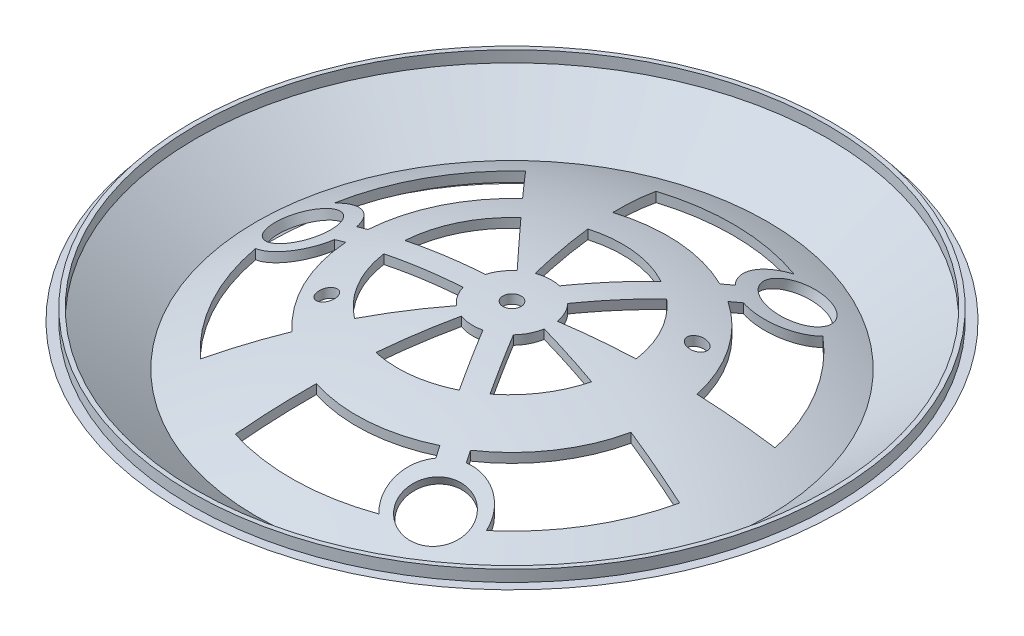
from build123d import *
from OCP.BRepAlgoAPI import BRepAlgoAPI_Cut
from OCP.TopTools import TopTools_ListOfShape
from build123d.topology import SkipClean

# Parameters (mm, degrees)
PATTERN_CIRCULAR_1_COUNT = 3
SKETCH_3_R               = 2
CUT_EXTRUDE_1_DEPTH      = 169
SKETCH_4_R               = 2
CUT_EXTRUDE_2_DEPTH      = 169
CUT_EXTRUDE_4_DEPTH      = 354


with BuildPart() as part:
    # 草图1 → 旋转1 (revolve)
    with BuildSketch(Plane.XY):
        with BuildLine():
            Line((-58.30765279, 114.509683547), (-56.061132597, 113.399291938))
            ThreePointArc((-56.061132597, 113.399291938), (-28.785756633, 123.181290036), (0, 126.5))
            Line((0, 126.5), (0, 128.5))
            ThreePointArc((0, 128.5), (-29.981291368, 124.953480015), (-58.30765279, 114.509683547))
        make_face()
    revolve(axis=Axis((0, 0, 0), (0, 1, 0)))

    # 草图2 → 切除-旋转1 (revolve, cut)
    with BuildSketch(Plane.XY):
        Polygon((-47.850176119, 124.653970552), (-53.965127913, 122.306660482), (-49.245091626, 110.010545566), (-43.130139832, 112.357855635), align=None)
    cut_revolve_1 = revolve(axis=Axis((0, 0, 0), (-0.3583679495453016, 0.9335804264972013, 0)), mode=Mode.SUBTRACT)

    # 阵列(圆周)1: 切除-旋转1 ×3 about axis
    pattern_circular_1_axis = Axis((0, 114.509683547, 0), (0, -1, 0))
    for i in range(1, PATTERN_CIRCULAR_1_COUNT):
        add(cut_revolve_1.rotate(pattern_circular_1_axis, i * 360 / PATTERN_CIRCULAR_1_COUNT), mode=Mode.SUBTRACT)

    # 草图3 → 切除-拉伸1 (cut)
    with BuildSketch(Plane(origin=(0, 0, 0), x_dir=(1, 0, 0), z_dir=(0, 1, 0))):
        with Locations((-25.044463349, -15.696803922)):
            Circle(SKETCH_3_R)
        with Locations((25.044463349, 15.696803922)):
            Circle(SKETCH_3_R)
    extrude(amount=CUT_EXTRUDE_1_DEPTH, mode=Mode.SUBTRACT)

    # 草图4 → 切除-拉伸2 (cut)
    with BuildSketch(Plane(origin=(0, 0, 0), x_dir=(1, 0, 0), z_dir=(0, 1, 0))):
        Circle(SKETCH_4_R)
    extrude(amount=CUT_EXTRUDE_2_DEPTH, mode=Mode.SUBTRACT)


with BuildPart() as cut_revolve_2_tool:
    # 草图6 → 切除-旋转2 (revolve)
    with BuildSketch(Plane.XY):
        Polygon((-72.5, 124.753817444), (-56.061132597, 113.399291938), (-72.5, 113.399291938), align=None)
    revolve(axis=Axis((0, 169.554002191, 0), (0, -1, 0)))


with BuildPart() as part_1:
    add(part.part)

    # 切除-旋转2: cut by cut_revolve_2_tool, with a tolerance
    cut_revolve_2_stock = TopTools_ListOfShape()
    cut_revolve_2_stock.Append(part_1.part.wrapped)
    cut_revolve_2_tools = TopTools_ListOfShape()
    cut_revolve_2_tools.Append(cut_revolve_2_tool.part.wrapped)
    cut_revolve_2_cut = BRepAlgoAPI_Cut()
    cut_revolve_2_cut.SetArguments(cut_revolve_2_stock)
    cut_revolve_2_cut.SetTools(cut_revolve_2_tools)
    cut_revolve_2_cut.SetFuzzyValue(0.00001)
    cut_revolve_2_cut.Build()
    add(Compound.cast(cut_revolve_2_cut.Shape()).solids(), mode=Mode.REPLACE)


with BuildPart() as revolve_2_tool:
    # 草图7 → 旋转2 (revolve)
    with SkipClean():  # the faces are left unmerged after this step: merging them gives an invalid solid
        with BuildSketch(Plane.XY):
            Polygon((56.061132597, 113.399291938), (72.5, 124.753817444), (70.5, 124.753817444), (70.5, 127.253817444), (69.5, 127.253817444), (69.5, 124.753817444), (53.061132597, 113.399291938), align=None)
        revolve(axis=Axis((0, 167.442227048, 0), (0, -1, 0)))


with BuildPart() as part_2:
    with SkipClean():  # the faces are left unmerged after this step: merging them gives an invalid solid
        add(part_1.part)


with BuildPart() as part_3:
    # 旋转2: joined with revolve_2_tool
    with SkipClean():  # the faces are left unmerged after this step: merging them gives an invalid solid
        add(part_2.part.fuse(revolve_2_tool.part, tol=0.00001))

    # 草图8 → 切除-拉伸4 (cut)
    with SkipClean():  # the faces are left unmerged after this step: merging them gives an invalid solid
        with BuildSketch(Plane(origin=(0, 0, 0), x_dir=(1, 0, 0), z_dir=(0, 1, 0))):
            with BuildLine():
                Line((8.545376282, -1.454851704), (22.115674636, -4.615088169))
                ThreePointArc((22.115674636, -4.615088169), (18.862366738, -12.12762567), (13.308989001, -18.142792143))
                Line((13.308989001, -18.142792143), (6.282464382, -5.972494502))
                ThreePointArc((6.282464382, -5.972494502), (7.750386365, -3.882210772), (8.545376282, -1.454851704))
            make_face()
            with BuildLine():
                Line((-3.012749607, -8.127938797), (-7.385889018, -22.530065145))
                ThreePointArc((-7.385889018, -22.530065145), (1.033172508, -23.081875352), (9.137534025, -20.735726192))
                Line((9.137534025, -20.735726192), (2.031099771, -8.427021004))
                ThreePointArc((2.031099771, -8.427021004), (-0.513100031, -8.653136867), (-3.012749607, -8.127938797))
            make_face()
            with BuildLine():
                Line((20.432635658, -30.481310088), (19.193542609, -28.335137972))
                ThreePointArc((19.193542609, -28.335137972), (28.352152314, -19.168400584), (33.446303131, -7.25375273))
                Line((33.446303131, -7.25375273), (47.380169306, -10.498656478))
                ThreePointArc((47.380169306, -10.498656478), (41.548793132, -25.07588524), (31.36864599, -37.028506318))
                ThreePointArc((31.36864599, -37.028506318), (27.259345365, -31.485416595), (20.432635658, -30.481310088))
            make_face()
            with BuildLine():
                Line((16.181271048, -32.93583659), (14.942177999, -30.789664474))
                ThreePointArc((14.942177999, -30.789664474), (2.424245699, -34.137884448), (-10.441217428, -32.592224539))
                Line((-10.441217428, -32.592224539), (-14.597981437, -46.281758494))
                ThreePointArc((-14.597981437, -46.281758494), (0.941957074, -48.520252969), (16.383304141, -45.680297468))
                ThreePointArc((16.383304141, -45.680297468), (13.637497937, -39.349993874), (16.181271048, -32.93583659))
            make_face()
            with BuildLine():
                Line((-5.532626675, -6.673087093), (-16.372017137, -18.252532936))
                ThreePointArc((-16.372017137, -18.252532936), (-22.602829863, -11.268948277), (-25.749169116, -2.454526502))
                Line((-25.749169116, -2.454526502), (-8.313564153, -2.454526502))
                ThreePointArc((-8.313564153, -2.454526502), (-7.237286334, -4.770926095), (-5.532626675, -6.673087093))
            make_face()
            with BuildLine():
                Line((-5.532626675, 6.673087093), (-17.642708801, 19.609980605))
                ThreePointArc((-17.642708801, 19.609980605), (-23.561577352, 11.881273885), (-25.991051834, 2.454526502))
                Line((-25.991051834, 2.454526502), (-8.313564153, 2.454526502))
                ThreePointArc((-8.313564153, 2.454526502), (-7.237286334, 4.770926095), (-5.532626675, 6.673087093))
            make_face()
            with BuildLine():
                Line((-36.613906706, -2.454526502), (-34.135720608, -2.454526502))
                ThreePointArc((-34.135720608, -2.454526502), (-30.776398013, -14.969483863), (-23.005085702, -25.338471809))
                Line((-23.005085702, -25.338471809), (-32.782187869, -35.783102016))
                ThreePointArc((-32.782187869, -35.783102016), (-42.490750207, -23.444367729), (-47.75195013, -8.65179115))
                ThreePointArc((-47.75195013, -8.65179115), (-40.896843302, -7.864577279), (-36.613906706, -2.454526502))
            make_face()
            with BuildLine():
                Line((-36.613906706, 2.454526502), (-34.135720608, 2.454526502))
                ThreePointArc((-34.135720608, 2.454526502), (-30.776398013, 14.969483863), (-23.005085702, 25.338471809))
                Line((-23.005085702, 25.338471809), (-32.782187869, 35.783102016))
                ThreePointArc((-32.782187869, 35.783102016), (-42.490750207, 23.444367729), (-47.75195013, 8.65179115))
                ThreePointArc((-47.75195013, 8.65179115), (-40.896843302, 7.864577279), (-36.613906706, 2.454526502))
            make_face()
            with BuildLine():
                Line((-3.012749607, 8.127938797), (-8.059107371, 24.747185357))
                ThreePointArc((-8.059107371, 24.747185357), (1.282326413, 25.44491857), (10.19917096, 22.574535302))
                Line((10.19917096, 22.574535302), (2.031099771, 8.427021004))
                ThreePointArc((2.031099771, 8.427021004), (-0.513100031, 8.653136867), (-3.012749607, 8.127938797))
            make_face()
            with BuildLine():
                Line((8.545376282, 1.454851704), (22.561589318, 4.7189323))
                ThreePointArc((22.561589318, 4.7189323), (19.774053388, 13.000923554), (14.249194494, 19.771275826))
                Line((14.249194494, 19.771275826), (6.282464382, 5.972494502))
                ThreePointArc((6.282464382, 5.972494502), (7.750386365, 3.882210772), (8.545376282, 1.454851704))
            make_face()
            with BuildLine():
                Line((16.181271048, 32.93583659), (14.942177999, 30.789664474))
                ThreePointArc((14.942177999, 30.789664474), (2.424245699, 34.137884448), (-10.441217428, 32.592224539))
                Line((-10.441217428, 32.592224539), (-14.597981437, 46.281758494))
                ThreePointArc((-14.597981437, 46.281758494), (0.941957074, 48.520252969), (16.383304141, 45.680297468))
                ThreePointArc((16.383304141, 45.680297468), (13.637497937, 39.349993874), (16.181271048, 32.93583659))
            make_face()
            with BuildLine():
                Line((20.432635658, 30.481310088), (19.193542609, 28.335137972))
                ThreePointArc((19.193542609, 28.335137972), (28.352152314, 19.168400584), (33.446303131, 7.25375273))
                Line((33.446303131, 7.25375273), (47.380169306, 10.498656478))
                ThreePointArc((47.380169306, 10.498656478), (41.548793132, 25.07588524), (31.36864599, 37.028506318))
                ThreePointArc((31.36864599, 37.028506318), (27.259345365, 31.485416595), (20.432635658, 30.481310088))
            make_face()
        extrude(amount=CUT_EXTRUDE_4_DEPTH, mode=Mode.SUBTRACT)


solid = part_3.part
